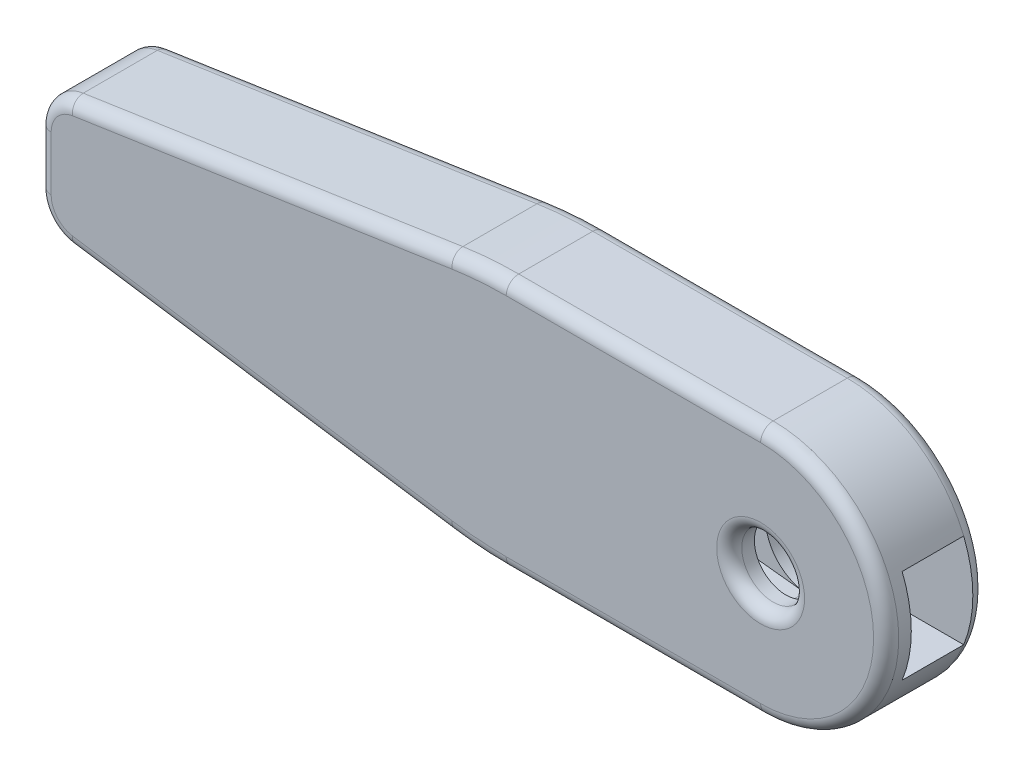
from build123d import *

# Parameters (mm, degrees)
BOSS_EXTRU_2_DEPTH      = 10.4
ESQUISSE2_R             = 2.5
ENL_V_MAT_EXTRU_1_DEPTH = 2.5
ENL_V_MAT_EXTRU_2_DEPTH = 1.9
ENL_V_MAT_EXTRU_3_DEPTH = 3
ESQUISSE6_R             = 2.625
ENL_V_MAT_EXTRU_4_DEPTH = 77.245393303
ESQUISSE8_W             = 4.091090074
ESQUISSE8_H             = 23.887427299
ENL_V_MAT_EXTRU_5_DEPTH = 79
ENL_V_MAT_EXTRU_6_REACH = 78.075
ESQUISSE9_R             = 2.5
CONG_2_R                = 1
CONG_3_R                = 1


with BuildPart() as part:
    # Esquisse1 → Boss.-Extru.2 (new body)
    with BuildSketch(Plane.XY):
        with BuildLine():
            Line((44.737484162, 10), (65, 10))
            ThreePointArc((65, 10), (75, 0), (65, -10))
            Line((65, -10), (44.737484162, -10))
            ThreePointArc((44.737484162, -10), (42.506197266, -9.916907574), (40.287270574, -9.668090586))
            Line((40.287270574, -9.668090586), (10.054978641, -5.133246796))
            ThreePointArc((10.054978641, -5.133246796), (8.226779369, -4.12410675), (7.5, -2.166437738))
            Line((7.5, -2.166437738), (7.5, 2.166437738))
            ThreePointArc((7.5, 2.166437738), (8.226779369, 4.12410675), (10.054978641, 5.133246796))
            Line((10.054978641, 5.133246796), (40.287270574, 9.668090586))
            ThreePointArc((40.287270574, 9.668090586), (42.506197266, 9.916907574), (44.737484162, 10))
        make_face()
    extrude(amount=BOSS_EXTRU_2_DEPTH)

    # Esquisse2 → Enlèv. mat.-Extru.1 (cut)
    with BuildSketch(Plane.XY.offset(10.4)):
        with Locations((65, 0)):
            Circle(ESQUISSE2_R)
    extrude(amount=-ENL_V_MAT_EXTRU_1_DEPTH, mode=Mode.SUBTRACT)

    # Esquisse3 → Enlèv. mat.-Extru.2 (cut)
    with BuildSketch(Plane.XY.offset(5.9)):
        with BuildLine():
            Line((87.5, 3.75), (87.5, -3.75))
            Line((87.5, -3.75), (65, -3.75))
            Line((65, -3.75), (65, -3.5))
            ThreePointArc((65, -3.5), (64.812229587, -3.494959552), (64.625, -3.479852727))
            Line((64.625, -3.479852727), (50.785714286, -1.988487272))
            ThreePointArc((50.785714286, -1.988487272), (49, 0), (50.785714286, 1.988487272))
            Line((50.785714286, 1.988487272), (64.625, 3.479852727))
            ThreePointArc((64.625, 3.479852727), (64.812229587, 3.494959552), (65, 3.5))
            Line((65, 3.5), (65, 3.75))
            Line((65, 3.75), (87.5, 3.75))
        make_face()
    extrude(amount=-ENL_V_MAT_EXTRU_2_DEPTH, mode=Mode.SUBTRACT)

    # Esquisse4 → Enlèv. mat.-Extru.3 (cut)
    with BuildSketch(Plane.XY.offset(4)):
        with BuildLine():
            Line((65, 3.5), (65, 3.75))
            Line((65, 3.75), (88.077593775, 3.75))
            Line((88.077593775, 3.75), (88.077593775, -3.75))
            Line((88.077593775, -3.75), (65, -3.75))
            Line((65, -3.75), (65, -3.5))
            ThreePointArc((65, -3.5), (61.5, 0), (65, 3.5))
        make_face()
    extrude(amount=-ENL_V_MAT_EXTRU_3_DEPTH, mode=Mode.SUBTRACT)

    # Esquisse6 → Enlèv. mat.-Extru.4 (cut, through all)
    with BuildSketch(Plane.XY.offset(1)):
        with Locations((65, 0)):
            Circle(ESQUISSE6_R)
    extrude(amount=-ENL_V_MAT_EXTRU_4_DEPTH, mode=Mode.SUBTRACT)

    # Esquisse8 → Enlèv. mat.-Extru.5 (cut)
    with BuildSketch(Plane(origin=(0, 0, 0), x_dir=(0, 0, -1), z_dir=(1, 0, 0))):
        with Locations((-9.945545037, 0.586827687)):
            Rectangle(ESQUISSE8_W, ESQUISSE8_H)
    extrude(amount=ENL_V_MAT_EXTRU_5_DEPTH, mode=Mode.SUBTRACT)

    # Esquisse9 → Enlèv. mat.-Extru.6 (cut, up to next)
    with BuildSketch(Plane.XY.offset(7.9), mode=Mode.PRIVATE) as enl_v_mat_extru_6_sk1:
        with Locations((65, 0)):
            Circle(ESQUISSE9_R)
    enl_v_mat_extru_6_tool1 = extrude(enl_v_mat_extru_6_sk1.sketch, amount=-ENL_V_MAT_EXTRU_6_REACH, mode=Mode.PRIVATE) & part.part
    add(enl_v_mat_extru_6_tool1.solids().sort_by_distance((65, 0, 7.9))[0], mode=Mode.SUBTRACT)

    # Congé2
    cong_2_edges = [part.edges().sort_by_distance(p)[0] for p in [
        (8.226779369, -4.12410675, 7.9),
        (25.171124608, -7.400668691, 7.9),
        (42.506197266, -9.916907574, 7.9),
        (54.868742081, -10, 7.9),
        (75, 0, 7.9),
        (54.868742081, 10, 7.9),
        (42.506197266, 9.916907574, 7.9),
        (25.171124608, 7.400668691, 7.9),
        (8.226779369, 4.12410675, 7.9),
        (7.5, 0, 7.9),
        (62.5, 0, 7.9),
    ]]
    fillet(cong_2_edges, radius=CONG_2_R)

    # Congé3
    cong_3_edges = [part.edges().sort_by_distance(p)[0] for p in [
        (7.5, 0, 0),
        (8.226779369, 4.12410675, 0),
        (25.171124608, 7.400668691, 0),
        (42.506197266, 9.916907574, 0),
        (54.868742081, 10, 0),
        (75, 0, 0),
        (54.868742081, -10, 0),
        (42.506197266, -9.916907574, 0),
        (25.171124608, -7.400668691, 0),
        (8.226779369, -4.12410675, 0),
        (62.375, 0, 0),
    ]]
    fillet(cong_3_edges, radius=CONG_3_R - 0.0001)  # a hair under: the kernel refuses the full size


solid = part.part
